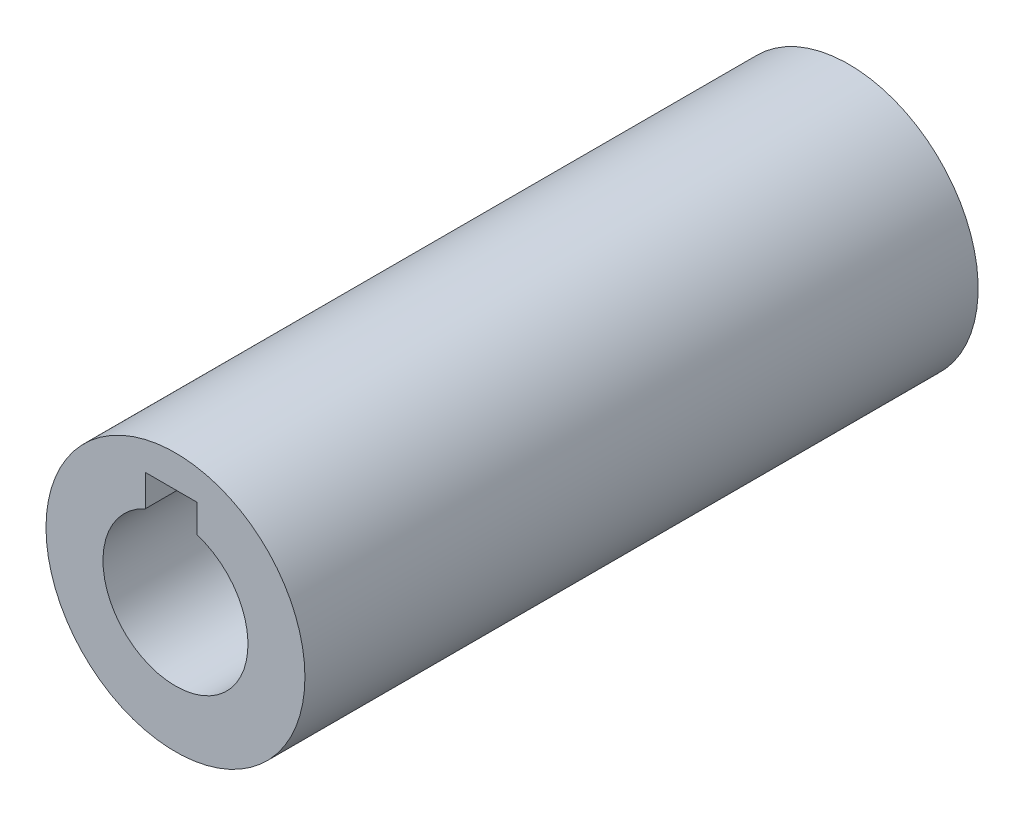
from build123d import *

# Parameters (mm, degrees)
SKETCH1_R           = 12.5
BOSS_EXTRUDE1_DEPTH = 30
BOSS_EXTRUDE2_START = 5
SKETCH4_R           = 12.5
BOSS_EXTRUDE2_DEPTH = 5
BOSS_EXTRUDE3_START = 30
SKETCH5_R           = 12.5
BOSS_EXTRUDE3_DEPTH = 30


with BuildPart() as part:
    # Sketch1 → Boss-Extrude1 (new body)
    with BuildSketch(Plane.XY):
        Circle(SKETCH1_R)
        with BuildLine():
            Line((-2.916666667, 6.3634154), (-2.916666667, 9.409059343))
            Line((-2.916666667, 9.409059343), (2.083333333, 9.409059343))
            Line((2.083333333, 9.409059343), (2.083333333, 6.682792996))
            ThreePointArc((2.083333333, 6.682792996), (0.446219255, -6.985763264), (-2.916666667, 6.3634154))
        make_face(mode=Mode.SUBTRACT)
    extrude(amount=BOSS_EXTRUDE1_DEPTH)

    # Sketch4 → Boss-Extrude2 (add)
    with BuildSketch(Plane(origin=(0, 0, 0), x_dir=(-1, 0, 0), z_dir=(0, 0, -1)).offset(BOSS_EXTRUDE2_START)):
        Circle(SKETCH4_R)
    extrude(amount=-BOSS_EXTRUDE2_DEPTH)

    # Sketch5 → Boss-Extrude3 (add)
    with BuildSketch(Plane(origin=(0, 0, -5), x_dir=(-1, 0, 0), z_dir=(0, 0, -1)).offset(BOSS_EXTRUDE3_START)):
        Circle(SKETCH5_R)
        with BuildLine():
            Line((1.25, 7.855680572), (1.25, 5.868347297))
            ThreePointArc((1.25, 5.868347297), (0, -6), (-1.25, 5.868347297))
            Line((-1.25, 5.868347297), (-1.25, 7.855680572))
            Line((-1.25, 7.855680572), (1.25, 7.855680572))
        make_face(mode=Mode.SUBTRACT)
    extrude(amount=-BOSS_EXTRUDE3_DEPTH)


solid = part.part
